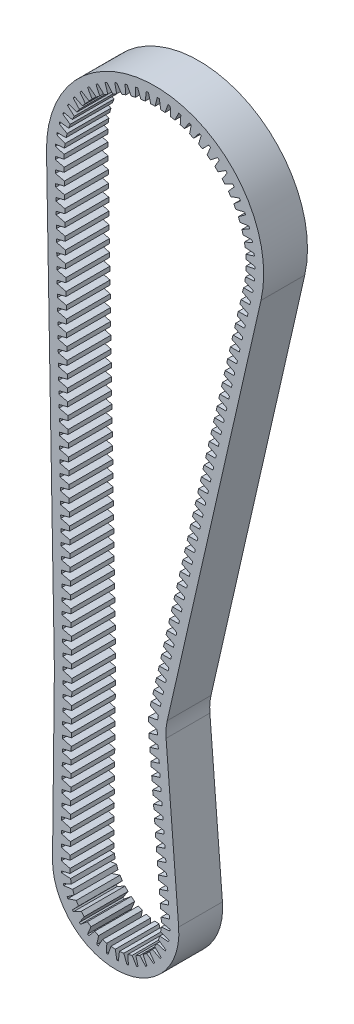
from build123d import *

# Parameters (mm, degrees)
EXTRUDE_THIN1_DEPTH = 5
BOSS_EXTRUDE1_DEPTH = 5
CRVPATTERN1_DEPTH   = 5


# Read off the part's stored shape, not the designer's step: CrvPattern1
with BuildPart() as part:
    # Sketch2 → Extrude-Thin1 (new body)
    with BuildSketch(Plane.XY):
        with BuildLine():
            Line((1.385711381, -49.665179676), (12.089250095, -2.75862867))
            ThreePointArc((12.089250095, -2.75862867), (1.27892399, 12.333870172), (-12.39805727, -0.219490152))
            Line((-12.39805727, -0.219490152), (-11.500940031, -50.893795088))
            ThreePointArc((-11.500940031, -50.893795088), (-11.500031082, -50.98068722), (-11.500380638, -51.067583404))
            Line((-11.500380638, -51.067583404), (-11.712731793, -69.918751351))
            ThreePointArc((-11.712731793, -69.918751351), (-4.252748113, -77.208950531), (2.690215624, -69.424760457))
            Line((2.690215624, -69.424760457), (1.254458326, -51.478489759))
            ThreePointArc((1.254458326, -51.478489759), (1.25100498, -50.5668345), (1.385711381, -49.665179676))
        make_face()
        with BuildLine():
            Line((0.410771857, -49.442709622), (11.114310571, -2.536158616))
            ThreePointArc((11.114310571, -2.536158616), (1.175784958, 11.339203223), (-11.398213942, -0.201789334))
            Line((-11.398213942, -0.201789334), (-10.501096702, -50.876094269))
            ThreePointArc((-10.501096702, -50.876094269), (-10.500036262, -50.977468424), (-10.500444078, -51.078847304))
            Line((-10.500444078, -51.078847304), (-10.712795232, -69.930015252))
            ThreePointArc((-10.712795232, -69.930015252), (-4.287025861, -76.209538186), (1.693400591, -69.50450875))
            Line((1.693400591, -69.50450875), (0.257643293, -51.558238053))
            ThreePointArc((0.257643293, -51.558238053), (0.253614389, -50.49464025), (0.410771857, -49.442709622))
        make_face(mode=Mode.SUBTRACT)
    extrude(amount=EXTRUDE_THIN1_DEPTH)

    # Sketch3 → Boss-Extrude1 (add)
    with BuildSketch(Plane.XY.offset(5)):
        Polygon((-10.071432817, -18.910253461), (-10.071432817, -18.410253461), (-11.080284613, -18.160253461), (-11.546624502, -18.160253461), (-11.546624502, -19.160253461), (-11.06258102, -19.160253461), align=None)
    extrude(amount=-BOSS_EXTRUDE1_DEPTH)

    # CrvPattern1 outline → CrvPattern1 (add)
    with BuildSketch(Plane.XY):
        Polygon((-10.047486615, -20.262871689), (-10.047486615, -19.762871689), (-11.056338411, -19.512871689), (-11.038634818, -20.512871689), align=None)
        Polygon((-10.095379018, -17.057635233), (-11.104230815, -16.807635233), (-11.086527222, -17.807635233), (-10.095379018, -17.557635233), align=None)
        Polygon((-10.11932522, -15.705017004), (-11.128177016, -15.455017004), (-11.110473424, -16.455017004), (-10.11932522, -16.205017004), align=None)
        Polygon((-10.143271422, -14.352398776), (-11.152123218, -14.102398776), (-11.134419626, -15.102398776), (-10.143271422, -14.852398776), align=None)
        Polygon((-10.167217624, -12.999780548), (-11.17606942, -12.749780548), (-11.158365828, -13.749780548), (-10.167217624, -13.499780548), align=None)
        Polygon((-10.191163826, -11.647162319), (-11.200015622, -11.397162319), (-11.18231203, -12.397162319), (-10.191163826, -12.147162319), align=None)
        Polygon((-10.215110027, -10.294544091), (-11.223961824, -10.044544091), (-11.206258231, -11.044544091), (-10.215110027, -10.794544091), align=None)
        Polygon((-10.239056229, -8.941925863), (-11.247908025, -8.691925863), (-11.230204433, -9.691925863), (-10.239056229, -9.441925863), align=None)
        Polygon((-10.263002431, -7.589307634), (-11.271854227, -7.339307634), (-11.254150635, -8.339307634), (-10.263002431, -8.089307634), align=None)
        Polygon((-10.286948633, -6.236689406), (-11.295800429, -5.986689406), (-11.278096837, -6.986689406), (-10.286948633, -6.736689406), align=None)
        Polygon((-10.310894834, -4.884071177), (-11.319746631, -4.634071177), (-11.302043038, -5.634071177), (-10.310894834, -5.384071177), align=None)
        Polygon((-10.334841036, -3.531452949), (-11.343692832, -3.281452949), (-11.32598924, -4.281452949), (-10.334841036, -4.031452949), align=None)
        Polygon((-10.358787238, -2.178834721), (-11.367639034, -1.928834721), (-11.349935442, -2.928834721), (-10.358787238, -2.678834721), align=None)
        Polygon((-10.38273344, -0.826216492), (-11.391585236, -0.576216492), (-11.373881644, -1.576216492), (-10.38273344, -1.326216492), align=None)
        with BuildLine():
            Line((-10.388682701, 0.449770606), (-11.376280904, 0.735005299))
            ThreePointArc((-11.376280904, 0.735005299), (-11.396876762, 0.266833433), (-11.398213942, -0.201789334))
            Line((-11.398213942, -0.201789334), (-11.397191712, -0.259530726))
            Line((-11.397191712, -0.259530726), (-10.407804198, -0.049863628))
            Line((-10.407804198, -0.049863628), (-10.388682701, 0.449770606))
        make_face()
        with BuildLine():
            Line((-10.277945309, 1.578246522), (-11.228614645, 1.96931794))
            ThreePointArc((-11.228614645, 1.96931794), (-11.303840902, 1.477559093), (-11.357540999, 0.982986496))
            Line((-11.357540999, 0.982986496), (-10.35135475, 1.083664826))
            Line((-10.35135475, 1.083664826), (-10.277945309, 1.578246522))
        make_face()
        with BuildLine():
            Line((-10.044994557, 2.687955767), (-10.947430773, 3.180213745))
            ThreePointArc((-10.947430773, 3.180213745), (-11.075753912, 2.699569463), (-11.182985243, 2.21378433))
            Line((-11.182985243, 2.21378433), (-10.171819042, 2.204307599))
            Line((-10.171819042, 2.204307599), (-10.044994557, 2.687955767))
        make_face()
        with BuildLine():
            Line((-9.692600424, 3.765702972), (-10.536072799, 4.353294151))
            ThreePointArc((-10.536072799, 4.353294151), (-10.715966951, 3.889479697), (-10.875454445, 3.418258418))
            Line((-10.875454445, 3.418258418), (-9.871331904, 3.298739313))
            Line((-9.871331904, 3.298739313), (-9.692600424, 3.765702972))
        make_face()
        with BuildLine():
            Line((-9.224953171, 4.798672821), (-9.999432114, 5.47461025))
            ThreePointArc((-9.999432114, 5.47461025), (-10.228758187, 5.033140765), (-10.438605405, 4.582086556))
            Line((-10.438605405, 4.582086556), (-9.453466379, 4.35394626))
            Line((-9.453466379, 4.35394626), (-9.224953171, 4.798672821))
        make_face()
        with BuildLine():
            Line((-8.647613515, 5.774582439), (-9.343889824, 6.530828658))
            ThreePointArc((-9.343889824, 6.530828658), (-9.619920939, 6.116953583), (-9.877632621, 5.691429856))
            Line((-9.877632621, 5.691429856), (-8.923191238, 5.357381146))
            Line((-8.923191238, 5.357381146), (-8.647613515, 5.774582439))
        make_face()
        with BuildLine():
            Line((-7.967446507, 6.681827446), (-8.577240874, 7.509390055))
            ThreePointArc((-8.577240874, 7.509390055), (-8.89669479, 7.128030711), (-9.19920653, 6.733097297))
            Line((-9.19920653, 6.733097297), (-8.286811895, 6.297112293))
            Line((-8.286811895, 6.297112293), (-7.967446507, 6.681827446))
        make_face()
        with BuildLine():
            Line((-7.1925399, 7.50961994), (-7.708601361, 8.398658527))
            ThreePointArc((-7.708601361, 8.398658527), (-8.067679505, 8.054349596), (-8.411394185, 7.694702585))
            Line((-8.411394185, 7.694702585), (-7.551895432, 7.161965512))
            Line((-7.551895432, 7.161965512), (-7.1925399, 7.50961994))
        make_face()
        with BuildLine():
            Line((-6.332107982, 8.248116776), (-6.748300135, 9.188059931))
            ThreePointArc((-6.748300135, 9.188059931), (-7.142732767, 8.884895532), (-7.523563332, 8.564811427))
            Line((-7.523563332, 8.564811427), (-6.727180621, 7.941656974))
            Line((-6.727180621, 7.941656974), (-6.332107982, 8.248116776))
        make_face()
        with BuildLine():
            Line((-5.396382009, 8.88853661), (-5.70775598, 9.868207622))
            ThreePointArc((-5.70775598, 9.868207622), (-6.132852967, 9.609792635), (-6.546271024, 9.333077503))
            Line((-6.546271024, 9.333077503), (-5.82247401, 8.626915498))
            Line((-5.82247401, 8.626915498), (-5.396382009, 8.88853661))
        make_face()
        with BuildLine():
            Line((-4.396488542, 9.423264315), (-4.599341836, 10.431014077))
            ThreePointArc((-4.599341836, 10.431014077), (-5.050048419, 10.220421271), (-5.491138081, 9.990365488))
            Line((-5.491138081, 9.990365488), (-4.848533316, 9.209592786))
            Line((-4.848533316, 9.209592786), (-4.396488542, 9.423264315))
        make_face()
        with BuildLine():
            Line((-3.344317153, 9.845941531), (-3.436237674, 10.869787056))
            ThreePointArc((-3.436237674, 10.869787056), (-3.907194575, 10.709520557), (-4.370710918, 10.528859676))
            Line((-4.370710918, 10.528859676), (-3.816939509, 9.682760319))
            Line((-3.816939509, 9.682760319), (-3.344317153, 9.845941531))
        make_face()
        with BuildLine():
            Line((-2.252379037, 10.151542273), (-2.232273773, 11.179309183))
            ThreePointArc((-2.232273773, 11.179309183), (-2.717880921, 11.071274692), (-3.198312348, 10.942156923))
            Line((-3.198312348, 10.942156923), (-2.739959101, 10.040791738))
            Line((-2.739959101, 10.040791738), (-2.252379037, 10.151542273))
        make_face()
        with BuildLine():
            Line((-1.133658252, 10.336432693), (-1.001766272, 11.355899979))
            ThreePointArc((-1.001766272, 11.355899979), (-1.496249393, 11.301382117), (-1.987883172, 11.225342779))
            Line((-1.987883172, 11.225342779), (-1.63039829, 10.279429752))
            Line((-1.63039829, 10.279429752), (-1.133658252, 10.336432693))
        make_face()
        with BuildLine():
            Line((-0.001457323, 10.398414289), (0.240653067, 11.397459634))
            ThreePointArc((0.240653067, 11.397459634), (-0.256826208, 11.397106664), (-0.753816403, 11.375049927))
            Line((-0.753816403, 11.375049927), (-0.50145068, 10.395836755))
            Line((-0.50145068, 10.395836755), (-0.001457323, 10.398414289))
        make_face()
        with BuildLine():
            Line((1.130760934, 10.336750049), (1.480210841, 11.303493967))
            ThreePointArc((1.480210841, 11.303493967), (0.985650856, 11.357310086), (0.489213873, 11.389498224))
            Line((0.489213873, 11.389498224), (0.633459598, 10.388628569))
            Line((0.633459598, 10.388628569), (1.130760934, 10.336750049))
        make_face()
        with BuildLine():
            Line((2.2495335, 10.15217321), (2.70216767, 11.07512031))
            ThreePointArc((2.70216767, 11.07512031), (2.216407706, 11.182465599), (1.726426987, 11.268515868))
            Line((1.726426987, 11.268515868), (1.760837512, 10.257890907))
            Line((1.760837512, 10.257890907), (2.2495335, 10.15217321))
        make_face()
        with BuildLine():
            Line((3.341557232, 9.846878547), (3.891993467, 10.715054216))
            ThreePointArc((3.891993467, 10.715054216), (3.420809616, 10.87465225), (2.943111441, 11.01354144))
            Line((2.943111441, 11.01354144), (2.867277596, 10.005178349))
            Line((2.867277596, 10.005178349), (3.341557232, 9.846878547))
        make_face()
        with BuildLine():
            Line((4.393847055, 9.424496269), (5.035540209, 10.227577172))
            ThreePointArc((5.035540209, 10.227577172), (4.584535241, 10.437530197), (4.12479984, 10.627606799))
            Line((4.12479984, 10.627606799), (3.939623353, 9.633495858))
            Line((3.939623353, 9.633495858), (4.393847055, 9.424496269))
        make_face()
        with BuildLine():
            Line((5.393890365, 8.890048852), (6.11921017, 9.618485686))
            ThreePointArc((6.11921017, 9.618485686), (5.693746911, 9.876297186), (5.257440922, 10.115301031))
            Line((5.257440922, 10.115301031), (4.965123695, 9.14726305))
            Line((4.965123695, 9.14726305), (5.393890365, 8.890048852))
        make_face()
        with BuildLine():
            Line((6.32979581, 8.249891325), (7.130117606, 8.895022368))
            ThreePointArc((7.130117606, 8.895022368), (6.73525517, 9.197626748), (6.327566637, 9.48271588))
            Line((6.327566637, 9.48271588), (5.931584567, 8.552261638))
            Line((5.931584567, 8.552261638), (6.32979581, 8.249891325))
        make_face()
        with BuildLine():
            Line((7.190434692, 7.511635694), (8.056241986, 8.065789798))
            ThreePointArc((8.056241986, 8.065789798), (7.696675617, 8.409588839), (7.322452296, 8.737373311))
            Line((7.322452296, 8.737373311), (6.827513941, 7.855566688))
            Line((6.827513941, 7.855566688), (7.190434692, 7.511635694))
        make_face()
        with BuildLine():
            Line((7.965573296, 6.684060437), (8.886570914, 7.140648247))
            ThreePointArc((8.886570914, 7.140648247), (8.566576158, 7.521553891), (8.230267878, 7.88813607))
            Line((8.230267878, 7.88813607), (7.642258468, 7.065462485))
            Line((7.642258468, 7.065462485), (7.965573296, 6.684060437))
        make_face()
        with BuildLine():
            Line((8.645994576, 5.777006115), (9.611231087, 6.13059842))
            ThreePointArc((9.611231087, 6.13059842), (9.334612948, 6.54408138), (9.040218695, 6.945102299))
            Line((9.040218695, 6.945102299), (8.366130154, 6.191344027))
            Line((8.366130154, 6.191344027), (8.645994576, 5.777006115))
        make_face()
        with BuildLine():
            Line((9.223607754, 4.801258361), (10.22160569, 5.047650653))
            ThreePointArc((10.22160569, 5.047650653), (9.991653388, 5.488794272), (9.742673756, 5.919485457))
            Line((9.742673756, 5.919485457), (8.99052156, 5.243605313))
            Line((8.99052156, 5.243605313), (9.223607754, 4.801258361))
        make_face()
        with BuildLine():
            Line((9.691544528, 3.768419633), (10.710436858, 3.904682102))
            ThreePointArc((10.710436858, 3.904682102), (10.529884719, 4.368240813), (10.329280284, 4.823480986))
            Line((10.329280284, 4.823480986), (9.508008151, 4.233515751))
            Line((9.508008151, 4.233515751), (9.691544528, 3.768419633))
        make_face()
        with BuildLine():
            Line((10.044240736, 2.690771246), (11.071911979, 2.715283617))
            ThreePointArc((11.071911979, 2.715283617), (10.942906919, 3.19574532), (10.793063035, 3.670121294))
            Line((10.793063035, 3.670121294), (9.912436578, 3.173086147))
            Line((9.912436578, 3.173086147), (10.044240736, 2.690771246))
        make_face()
        with BuildLine():
            Line((10.277502527, 1.58112734), (11.301732814, 1.49359814))
            ThreePointArc((11.301732814, 1.49359814), (11.22580881, 1.985249744), (11.128507247, 2.473120792))
            Line((11.128507247, 2.473120792), (10.19899785, 2.074925897))
            Line((10.19899785, 2.074925897), (10.277502527, 1.58112734))
        make_face()
        with BuildLine():
            Line((10.388556223, 0.452682508), (11.397166599, 0.254152533))
            ThreePointArc((11.397166599, 0.254152533), (11.375226452, 0.751147889), (11.331624206, 1.246712817))
            Line((11.331624206, 1.246712817), (10.364284512, 0.952093044))
            Line((10.364284512, 0.952093044), (10.388556223, 0.452682508))
        make_face()
        with BuildLine():
            Line((10.376081303, -0.681145098), (11.357078548, -0.98831516))
            ThreePointArc((11.357078548, -0.98831516), (11.389383144, -0.491885742), (11.399998682, 0.005480385))
            Line((11.399998682, 0.005480385), (10.40633117, -0.182060991))
            Line((10.40633117, -0.182060991), (10.376081303, -0.681145098))
        make_face()
        with BuildLine():
            Line((10.240226105, -1.806873318), (11.18194534, -2.21903096))
            ThreePointArc((11.18194534, -2.21903096), (11.268110552, -1.729070441), (11.332817646, -1.235817214))
            Line((11.332817646, -1.235817214), (10.324637852, -1.314050168))
            Line((10.324637852, -1.314050168), (10.240226105, -1.806873318))
        make_face()
        with BuildLine():
            Line((9.981459393, -2.9865242), (10.900978918, -3.471050555))
            Line((10.900978918, -3.471050555), (11.114310571, -2.536158616))
            ThreePointArc((11.114310571, -2.536158616), (11.118877114, -2.516062742), (11.123407321, -2.495958646))
            Line((11.123407321, -2.495958646), (10.101305606, -2.501099762))
            Line((10.101305606, -2.501099762), (9.981459393, -2.9865242))
        make_face()
        Polygon((9.68049519, -4.30545181), (10.600014715, -4.789978165), (10.822519629, -3.814885872), (9.800341403, -3.820027372), align=None)
        Polygon((9.379530987, -5.62437942), (10.299050513, -6.108905775), (10.521555426, -5.133813482), (9.4993772, -5.138954982), align=None)
        Polygon((9.078566784, -6.943307031), (9.99808631, -7.427833385), (10.220591224, -6.452741092), (9.198412997, -6.457882592), align=None)
        Polygon((8.777602581, -8.262234641), (9.697122107, -8.746760995), (9.919627021, -7.771668702), (8.897448794, -7.776810203), align=None)
        Polygon((8.476638378, -9.581162251), (9.396157904, -10.065688606), (9.618662818, -9.090596312), (8.596484591, -9.095737813), align=None)
        Polygon((8.175674175, -10.900089861), (9.095193701, -11.384616216), (9.317698615, -10.409523922), (8.295520388, -10.414665423), align=None)
        Polygon((7.874709972, -12.219017471), (8.794229498, -12.703543826), (9.016734412, -11.728451533), (7.994556185, -11.733593033), align=None)
        Polygon((7.573745769, -13.537945081), (8.493265295, -14.022471436), (8.715770209, -13.047379143), (7.693591982, -13.052520643), align=None)
        Polygon((7.272781566, -14.856872692), (8.192301092, -15.341399046), (8.414806006, -14.366306753), (7.39262778, -14.371448253), align=None)
        Polygon((6.971817363, -16.175800302), (7.891336889, -16.660326656), (8.113841803, -15.685234363), (7.091663577, -15.690375864), align=None)
        Polygon((6.67085316, -17.494727912), (7.590372686, -17.979254266), (7.8128776, -17.004161973), (6.790699374, -17.009303474), align=None)
        Polygon((6.369888957, -18.813655522), (7.289408483, -19.298181877), (7.511913397, -18.323089583), (6.489735171, -18.328231084), align=None)
        Polygon((6.068924754, -20.132583132), (6.98844428, -20.617109487), (7.210949194, -19.642017194), (6.188770968, -19.647158694), align=None)
        Polygon((5.767960551, -21.451510742), (6.687480077, -21.936037097), (6.909984991, -20.960944804), (5.887806765, -20.966086304), align=None)
        Polygon((5.466996348, -22.770438352), (6.386515874, -23.254964707), (6.609020788, -22.279872414), (5.586842562, -22.285013914), align=None)
        Polygon((5.166032145, -24.089365963), (6.085551671, -24.573892317), (6.308056585, -23.598800024), (5.285878359, -23.603941524), align=None)
        Polygon((4.865067942, -25.408293573), (5.784587468, -25.892819927), (6.007092382, -24.917727634), (4.984914156, -24.922869135), align=None)
        Polygon((4.564103739, -26.727221183), (5.483623265, -27.211747538), (5.706128179, -26.236655244), (4.683949953, -26.241796745), align=None)
        Polygon((4.263139536, -28.046148793), (5.182659062, -28.530675148), (5.405163977, -27.555582854), (4.38298575, -27.560724355), align=None)
        Polygon((3.962175333, -29.365076403), (4.881694859, -29.849602758), (5.104199773, -28.874510465), (4.082021547, -28.879651965), align=None)
        Polygon((3.66121113, -30.684004013), (4.580730656, -31.168530368), (4.803235571, -30.193438075), (3.781057344, -30.198579575), align=None)
        Polygon((3.360246927, -32.002931624), (4.279766453, -32.487457978), (4.502271368, -31.512365685), (3.480093141, -31.517507185), align=None)
        Polygon((3.059282725, -33.321859234), (3.97880225, -33.806385588), (4.201307165, -32.831293295), (3.179128938, -32.836434796), align=None)
        Polygon((2.758318522, -34.640786844), (3.677838047, -35.125313198), (3.900342962, -34.150220905), (2.878164735, -34.155362406), align=None)
        Polygon((2.457354319, -35.959714454), (3.376873844, -36.444240809), (3.599378759, -35.469148515), (2.577200532, -35.474290016), align=None)
        Polygon((2.156390116, -37.278642064), (3.075909641, -37.763168419), (3.298414556, -36.788076126), (2.276236329, -36.793217626), align=None)
        Polygon((1.855425913, -38.597569674), (2.774945439, -39.082096029), (2.997450353, -38.107003736), (1.975272126, -38.112145236), align=None)
        Polygon((1.55446171, -39.916497284), (2.473981236, -40.401023639), (2.69648615, -39.425931346), (1.674307923, -39.431072846), align=None)
        Polygon((1.253497507, -41.235424895), (2.173017033, -41.719951249), (2.395521947, -40.744858956), (1.37334372, -40.750000457), align=None)
        Polygon((0.952533304, -42.554352505), (1.87205283, -43.038878859), (2.094557744, -42.063786566), (1.072379517, -42.068928067), align=None)
        Polygon((0.651569101, -43.873280115), (1.571088627, -44.35780647), (1.793593541, -43.382714176), (0.771415314, -43.387855677), align=None)
        Polygon((0.350604898, -45.192207725), (1.270124424, -45.67673408), (1.492629338, -44.701641786), (0.470451111, -44.706783287), align=None)
        Polygon((0.049640695, -46.511135335), (0.969160221, -46.99566169), (1.191665135, -46.020569397), (0.169486908, -46.025710897), align=None)
        Polygon((-0.251323508, -47.830062945), (0.668196018, -48.3145893), (0.890700932, -47.339497007), (-0.131477294, -47.344638507), align=None)
        with BuildLine():
            Line((0.367231815, -49.63351691), (0.369890251, -49.63417325))
            ThreePointArc((0.369890251, -49.63417325), (0.389661652, -49.538298504), (0.410771857, -49.442709622))
            Line((0.410771857, -49.442709622), (0.589736729, -48.658424617))
            Line((0.589736729, -48.658424617), (-0.432441497, -48.663566117))
            Line((-0.432441497, -48.663566117), (-0.552287711, -49.148990556))
            Line((-0.552287711, -49.148990556), (0.367231815, -49.63351691))
        make_face()
        with BuildLine():
            Line((0.218866813, -51.151710505), (0.237019616, -51.152946095))
            ThreePointArc((0.237019616, -51.152946095), (0.243974776, -50.652590845), (0.286657817, -50.154010954))
            Line((0.286657817, -50.154010954), (0.269113056, -50.152816751))
            Line((0.269113056, -50.152816751), (-0.736724345, -50.33493178))
            Line((-0.736724345, -50.33493178), (-0.770678829, -50.833777541))
            Line((-0.770678829, -50.833777541), (0.218866813, -51.151710505))
        make_face()
        Polygon((-0.678952429, -52.444223621), (0.343475596, -52.631100262), (0.263714807, -51.634129032), (-0.709998108, -51.945188386), align=None)
        Polygon((-0.571066531, -53.79274508), (0.451361494, -53.979621721), (0.371600704, -52.982650491), (-0.60211221, -53.293709845), align=None)
        Polygon((-0.463180634, -55.141266539), (0.559247392, -55.32814318), (0.479486602, -54.33117195), (-0.494226312, -54.642231304), align=None)
        Polygon((-0.355294736, -56.489787998), (0.66713329, -56.676664639), (0.5873725, -55.679693409), (-0.386340414, -55.990752763), align=None)
        Polygon((-0.247408838, -57.838309457), (0.775019188, -58.025186098), (0.695258398, -57.028214868), (-0.278454516, -57.339274222), align=None)
        Polygon((-0.13952294, -59.186830916), (0.882905085, -59.373707557), (0.803144296, -58.376736327), (-0.170568619, -58.687795681), align=None)
        Polygon((-0.031637042, -60.535352375), (0.990790983, -60.722229016), (0.911030193, -59.725257785), (-0.062682721, -60.03631714), align=None)
        Polygon((0.076248855, -61.883873834), (1.098676881, -62.070750475), (1.018916091, -61.073779244), (0.045203177, -61.384838599), align=None)
        Polygon((0.184134753, -63.232395293), (1.206562779, -63.419271934), (1.126801989, -62.422300703), (0.153089075, -62.733360058), align=None)
        Polygon((0.292020651, -64.580916752), (1.314448677, -64.767793393), (1.234687887, -63.770822162), (0.260974973, -64.081881517), align=None)
        Polygon((0.399906549, -65.929438211), (1.422334575, -66.116314852), (1.342573785, -65.119343621), (0.36886087, -65.430402976), align=None)
        Polygon((0.507792447, -67.27795967), (1.530220472, -67.464836311), (1.450459682, -66.46786508), (0.476746768, -66.778924435), align=None)
        Polygon((0.615678344, -68.626481129), (1.63810637, -68.81335777), (1.55834558, -67.816386539), (0.584632666, -68.127445894), align=None)
        with BuildLine():
            Line((0.713834843, -69.932384141), (1.71167699, -70.137081861))
            ThreePointArc((1.71167699, -70.137081861), (1.710597768, -69.820562464), (1.693400591, -69.50450875))
            Line((1.693400591, -69.50450875), (1.664676676, -69.145473729))
            Line((1.664676676, -69.145473729), (0.693550519, -69.432795765))
            Line((0.693550519, -69.432795765), (0.713834843, -69.932384141))
        make_face()
        with BuildLine():
            Line((0.635012571, -70.905699492), (1.577190352, -71.292857258))
            ThreePointArc((1.577190352, -71.292857258), (1.660891185, -70.804451534), (1.705404552, -70.310928951))
            Line((1.705404552, -70.310928951), (0.708233175, -70.411089805))
            Line((0.708233175, -70.411089805), (0.635012571, -70.905699492))
        make_face()
        with BuildLine():
            Line((0.37609598, -71.847250299), (1.22956549, -72.403289778))
            ThreePointArc((1.22956549, -72.403289778), (1.402862749, -71.93905488), (1.538613779, -71.462486271))
            Line((1.538613779, -71.462486271), (0.540253532, -71.374966171))
            Line((0.540253532, -71.374966171), (0.37609598, -71.847250299))
        make_face()
        with BuildLine():
            Line((-0.05383425, -72.724014647), (0.680994248, -73.429434512))
            ThreePointArc((0.680994248, -73.429434512), (0.937810079, -73.00565201), (1.160037734, -72.562751513))
            Line((1.160037734, -72.562751513), (0.195502943, -72.290619948))
            Line((0.195502943, -72.290619948), (-0.05383425, -72.724014647))
        make_face()
        with BuildLine():
            Line((-0.639699675, -73.505242799), (-0.049283976, -74.335302681))
            ThreePointArc((-0.049283976, -74.335302681), (0.282043426, -73.966835406), (0.582953773, -73.573136354))
            Line((0.582953773, -73.573136354), (-0.313927555, -73.125937479))
            Line((-0.313927555, -73.125937479), (-0.639699675, -73.505242799))
        make_face()
        with BuildLine():
            Line((-1.360952921, -74.16353565), (-0.935656982, -75.089123826))
            ThreePointArc((-0.935656982, -75.089123826), (-0.54143827, -74.788894601), (-0.172398709, -74.458204743))
            Line((-0.172398709, -74.458204743), (-0.9701713, -73.851622643))
            Line((-0.9701713, -73.851622643), (-1.360952921, -74.16353565))
        make_face()
        with BuildLine():
            Line((-2.192298311, -74.675805662), (-1.947038043, -75.664460055))
            ThreePointArc((-1.947038043, -75.664460055), (-1.503753995, -75.44299847), (-1.079528113, -75.186915706))
            Line((-1.079528113, -75.186915706), (-1.750212618, -74.442224329))
            Line((-1.750212618, -74.442224329), (-2.192298311, -74.675805662))
        make_face()
        with BuildLine():
            Line((-3.104579037, -75.024086585), (-3.047956166, -76.041133269))
            ThreePointArc((-3.047956166, -76.041133269), (-2.571153568, -75.906206389), (-2.106619747, -75.733712012))
            Line((-2.106619747, -75.733712012), (-2.626694028, -74.877029052))
            Line((-2.626694028, -74.877029052), (-3.104579037, -75.024086585))
        make_face()
        with BuildLine():
            Line((-4.065799738, -75.196163566), (-4.199800132, -76.205932847))
            ThreePointArc((-4.199800132, -76.205932847), (-3.706201326, -76.162272806), (-3.217651621, -76.07941651))
            Line((-3.217651621, -76.07941651), (-3.568875718, -75.140787411))
            Line((-3.568875718, -75.140787411), (-4.065799738, -75.196163566))
        make_face()
        with BuildLine():
            Line((-5.042248639, -75.186001551), (-5.36217266, -76.153078967))
            ThreePointArc((-5.36217266, -76.153078967), (-4.869089062, -76.202217001), (-4.373657807, -76.211904709))
            Line((-4.373657807, -76.211904709), (-4.543713646, -75.224248917))
            Line((-4.543713646, -75.224248917), (-5.042248639, -75.186001551))
        make_face()
        with BuildLine():
            Line((-5.999679885, -74.99395694), (-6.494307208, -75.88442531))
            ThreePointArc((-6.494307208, -75.88442531), (-6.019032166, -76.024638059), (-5.534095045, -76.126530005))
            Line((-5.534095045, -76.126530005), (-5.517018456, -75.124486422))
            Line((-5.517018456, -75.124486422), (-5.999679885, -74.99395694))
        make_face()
        with BuildLine():
            Line((-6.904514603, -74.62676509), (-7.556497742, -75.409394053))
            ThreePointArc((-7.556497742, -75.409394053), (-7.115700024, -75.635763999), (-6.658264672, -75.826286645))
            Line((-6.658264672, -75.826286645), (-6.454654562, -74.84499878))
            Line((-6.454654562, -74.84499878), (-6.904514603, -74.62676509))
        make_face()
        with BuildLine():
            Line((-7.72501858, -74.097304093), (-8.511491288, -74.744645415))
            ThreePointArc((-8.511491288, -74.744645415), (-8.12063048, -75.049233347), (-7.706739994, -75.321704715))
            Line((-7.706739994, -75.321704715), (-7.323737344, -74.395588135))
            Line((-7.323737344, -74.395588135), (-7.72501858, -74.097304093))
        make_face()
        with BuildLine():
            Line((-8.432415234, -73.424143119), (-9.325794469, -73.913493351))
            ThreePointArc((-9.325794469, -73.913493351), (-8.998578776, -74.285616812), (-8.642749056, -74.63048083))
            Line((-8.642749056, -74.63048083), (-8.093786472, -73.792016143))
            Line((-8.093786472, -73.792016143), (-8.432415234, -73.424143119))
        make_face()
        with BuildLine():
            Line((-9.001894866, -72.630891159), (-9.970848178, -72.94508789))
            ThreePointArc((-9.970848178, -72.94508789), (-9.718753655, -73.371695827), (-9.433464303, -73.776857481))
            Line((-9.433464303, -73.776857481), (-8.737794911, -73.055451183))
            Line((-8.737794911, -73.055451183), (-9.001894866, -72.630891159))
        make_face()
        with BuildLine():
            Line((-9.413484779, -71.745369016), (-10.424029196, -71.873392789))
            ThreePointArc((-10.424029196, -71.873392789), (-10.255897262, -72.339523278), (-10.051153899, -72.790772805))
            Line((-10.051153899, -72.790772805), (-9.233176101, -72.21172594))
            Line((-9.233176101, -72.21172594), (-9.413484779, -71.745369016))
        make_face()
        with BuildLine():
            Line((-9.65274976, -70.798633577), (-10.669443634, -70.735994364))
            ThreePointArc((-10.669443634, -70.735994364), (-10.591170984, -71.225299353), (-10.474154336, -71.706810604))
            Line((-10.474154336, -71.706810604), (-9.562556115, -71.290431407))
            Line((-9.562556115, -71.290431407), (-9.65274976, -70.798633577))
        make_face()
        with BuildLine():
            Line((-9.711298346, -69.823888591), (-10.708741761, -69.570174143))
            Line((-10.708741761, -69.570174143), (-10.712795232, -69.930015252))
            ThreePointArc((-10.712795232, -69.930015252), (-10.708284886, -70.24682226), (-10.687630211, -70.56298742))
            Line((-10.687630211, -70.56298742), (-9.714382991, -70.323879076))
            Line((-9.714382991, -70.323879076), (-9.711298346, -69.823888591))
        make_face()
        Polygon((-9.692543952, -68.516826066), (-10.693732096, -68.23771274), (-10.704997761, -69.237805987), (-9.707024868, -69.016616325), align=None)
        Polygon((-9.677305808, -67.16408171), (-10.678493951, -66.884968385), (-10.689759616, -67.885061631), (-9.691786724, -67.663871969), align=None)
        Polygon((-9.662067663, -65.811337355), (-10.663255806, -65.532224029), (-10.674521472, -66.532317276), (-9.676548579, -66.311127614), align=None)
        Polygon((-9.646829518, -64.458592999), (-10.648017662, -64.179479674), (-10.659283327, -65.17957292), (-9.661310434, -64.958383258), align=None)
        Polygon((-9.631591374, -63.105848644), (-10.632779517, -62.826735318), (-10.644045182, -63.826828565), (-9.646072289, -63.605638903), align=None)
        Polygon((-9.616353229, -61.753104288), (-10.617541372, -61.473990963), (-10.628807037, -62.474084209), (-9.630834145, -62.252894547), align=None)
        Polygon((-9.601115084, -60.400359933), (-10.602303227, -60.121246607), (-10.613568893, -61.121339854), (-9.615596, -60.900150192), align=None)
        Polygon((-9.585876939, -59.047615577), (-10.587065083, -58.768502252), (-10.598330748, -59.768595499), (-9.600357855, -59.547405836), align=None)
        Polygon((-9.570638795, -57.694871222), (-10.571826938, -57.415757896), (-10.583092603, -58.415851143), (-9.585119711, -58.194661481), align=None)
        Polygon((-9.55540065, -56.342126866), (-10.556588793, -56.063013541), (-10.567854459, -57.063106788), (-9.569881566, -56.841917126), align=None)
        Polygon((-9.540162505, -54.989382511), (-10.541350649, -54.710269186), (-10.552616314, -55.710362432), (-9.554643421, -55.48917277), align=None)
        Polygon((-9.524924361, -53.636638156), (-10.526112504, -53.35752483), (-10.537378169, -54.357618077), (-9.539405276, -54.136428415), align=None)
        Polygon((-9.509686216, -52.2838938), (-10.510874359, -52.004780475), (-10.522140025, -53.004873721), (-9.524167132, -52.783684059), align=None)
        with BuildLine():
            Line((-10.495636214, -50.652036119), (-10.505068175, -50.651762838))
            Line((-10.505068175, -50.651762838), (-10.501096702, -50.876094269))
            ThreePointArc((-10.501096702, -50.876094269), (-10.500036262, -50.977468423), (-10.500444078, -51.078847304))
            Line((-10.500444078, -51.078847304), (-10.50690188, -51.652129366))
            Line((-10.50690188, -51.652129366), (-9.508928987, -51.430939704))
            Line((-9.508928987, -51.430939704), (-9.494448071, -50.931149445))
            Line((-9.494448071, -50.931149445), (-10.495636214, -50.652036119))
        make_face()
        Polygon((-9.520670176, -49.520472714), (-10.529521972, -49.270472714), (-10.511818379, -50.270472714), (-9.520670176, -50.020472714), align=None)
        Polygon((-9.544616377, -48.167854485), (-10.553468174, -47.917854485), (-10.535764581, -48.917854485), (-9.544616377, -48.667854485), align=None)
        Polygon((-9.568562579, -46.815236257), (-10.577414375, -46.565236257), (-10.559710783, -47.565236257), (-9.568562579, -47.315236257), align=None)
        Polygon((-9.592508781, -45.462618028), (-10.601360577, -45.212618028), (-10.583656984, -46.212618028), (-9.592508781, -45.962618028), align=None)
        Polygon((-9.616454983, -44.1099998), (-10.625306779, -43.8599998), (-10.607603186, -44.8599998), (-9.616454983, -44.6099998), align=None)
        Polygon((-9.640401185, -42.757381572), (-10.649252981, -42.507381572), (-10.631549388, -43.507381572), (-9.640401185, -43.257381572), align=None)
        Polygon((-9.664347386, -41.404763343), (-10.673199183, -41.154763343), (-10.65549559, -42.154763343), (-9.664347386, -41.904763343), align=None)
        Polygon((-9.688293588, -40.052145115), (-10.697145384, -39.802145115), (-10.679441792, -40.802145115), (-9.688293588, -40.552145115), align=None)
        Polygon((-9.71223979, -38.699526887), (-10.721091586, -38.449526887), (-10.703387993, -39.449526887), (-9.71223979, -39.199526887), align=None)
        Polygon((-9.736185992, -37.346908658), (-10.745037788, -37.096908658), (-10.727334195, -38.096908658), (-9.736185992, -37.846908658), align=None)
        Polygon((-9.760132194, -35.99429043), (-10.76898399, -35.74429043), (-10.751280397, -36.74429043), (-9.760132194, -36.49429043), align=None)
        Polygon((-9.784078395, -34.641672201), (-10.792930191, -34.391672201), (-10.775226599, -35.391672201), (-9.784078395, -35.141672201), align=None)
        Polygon((-9.808024597, -33.289053973), (-10.816876393, -33.039053973), (-10.7991728, -34.039053973), (-9.808024597, -33.789053973), align=None)
        Polygon((-9.831970799, -31.936435745), (-10.840822595, -31.686435745), (-10.823119002, -32.686435745), (-9.831970799, -32.436435745), align=None)
        Polygon((-9.855917001, -30.583817516), (-10.864768797, -30.333817516), (-10.847065204, -31.333817516), (-9.855917001, -31.083817516), align=None)
        Polygon((-9.879863202, -29.231199288), (-10.888714999, -28.981199288), (-10.871011406, -29.981199288), (-9.879863202, -29.731199288), align=None)
        Polygon((-9.903809404, -27.87858106), (-10.9126612, -27.62858106), (-10.894957608, -28.62858106), (-9.903809404, -28.37858106), align=None)
        Polygon((-9.927755606, -26.525962831), (-10.936607402, -26.275962831), (-10.918903809, -27.275962831), (-9.927755606, -27.025962831), align=None)
        Polygon((-9.951701808, -25.173344603), (-10.960553604, -24.923344603), (-10.942850011, -25.923344603), (-9.951701808, -25.673344603), align=None)
        Polygon((-9.97564801, -23.820726375), (-10.984499806, -23.570726375), (-10.966796213, -24.570726375), (-9.97564801, -24.320726375), align=None)
        Polygon((-9.999594211, -22.468108146), (-11.008446007, -22.218108146), (-10.990742415, -23.218108146), (-9.999594211, -22.968108146), align=None)
        Polygon((-10.023540413, -21.115489918), (-11.032392209, -20.865489918), (-11.014688616, -21.865489918), (-10.023540413, -21.615489918), align=None)
    extrude(amount=CRVPATTERN1_DEPTH)


solid = part.part
